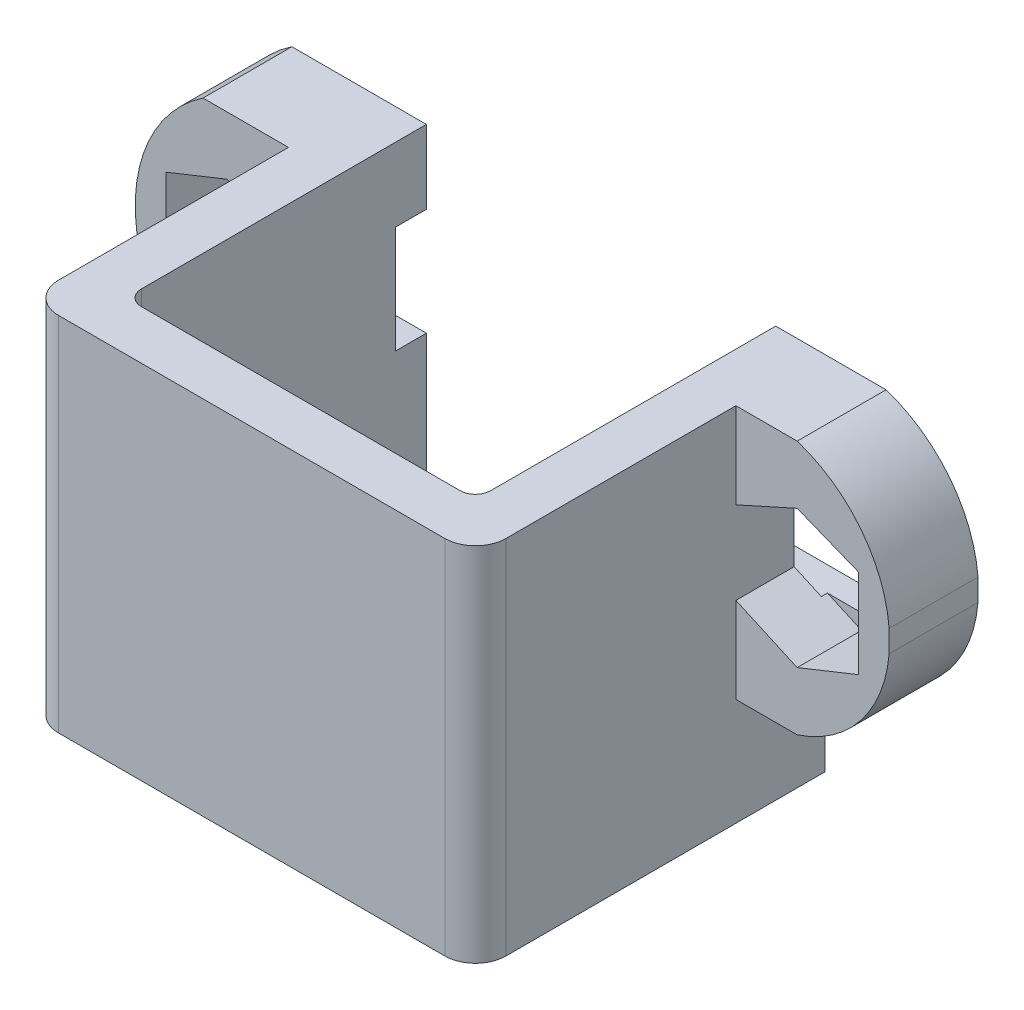
from build123d import *

# Parameters (mm, degrees)
EXTRUDE_1_DEPTH      = 11.4
SKETCH_2_W           = 11.4
SKETCH_2_H           = 8.3
CUT_EXTRUDE_1_DEPTH  = 9.8
CUT_EXTRUDE_2_DEPTH  = 10.6
CUT_EXTRUDE_3_DEPTH  = 0.8
CUT_EXTRUDE_4_DEPTH  = 8.5
CUT_EXTRUDE_5_DEPTH  = 0.8
CUT_EXTRUDE_6_DEPTH  = 2.1
CUT_EXTRUDE_7_DEPTH  = 0.2
CUT_EXTRUDE_8_DEPTH  = 1
CUT_EXTRUDE_9_DEPTH  = 8.5
CUT_EXTRUDE_10_DEPTH = 1.9
CUT_EXTRUDE_11_DEPTH = 0.2
EXTRUDE_2_DEPTH      = 3.5
FILLET_1_R           = 0.5
FILLET_2_R           = 1
FILLET_3_R           = 1.5


with BuildPart() as part:
    # 草图1 → 凸台-拉伸1 (new body)
    with BuildSketch(Plane.XY.offset(1.6)):
        with BuildLine():
            Line((-10.088816953, -2.4), (9.3, -2.4))
            ThreePointArc((9.3, -2.4), (11.373008704, -0.957826085), (12.3, 1.391198782))
            Line((12.3, 1.391198782), (12.3, 2.108801218))
            ThreePointArc((12.3, 2.108801218), (11.373008704, 4.457826085), (9.3, 5.9))
            Line((9.3, 5.9), (-10.088816953, 5.9))
            ThreePointArc((-10.088816953, 5.9), (-12.3, 1.75), (-10.088816953, -2.4))
        make_face()
        with BuildLine():
            Line((-7.8, 0), (-10.8, 0))
            Line((-10.8, 0), (-11.007, 0.0828))
            Line((-11.007, 0.0828), (-11.007, 2))
            ThreePointArc((-11.007, 2), (-10.567660172, 3.060660172), (-9.507, 3.5))
            Line((-9.507, 3.5), (-8.05, 3.5))
            Line((-8.05, 3.5), (-7.3, 3.2))
            Line((-7.3, 3.2), (-7.3, 0.2))
            Line((-7.3, 0.2), (-7.8, 0))
        make_face(mode=Mode.SUBTRACT)
        with BuildLine():
            Line((7.3, 0.4), (7.3, 3.1))
            Line((7.3, 3.1), (8.188888889, 3.5))
            Line((8.188888889, 3.5), (9.206872393, 3.5))
            ThreePointArc((9.206872393, 3.5), (10.461862433, 2.99034879), (11.006177815, 1.75))
            ThreePointArc((11.006177815, 1.75), (10.461862433, 0.50965121), (9.206872393, 0))
            Line((9.206872393, 0), (8.188888889, 0))
            Line((8.188888889, 0), (7.3, 0.4))
        make_face(mode=Mode.SUBTRACT)
    extrude(amount=-EXTRUDE_1_DEPTH)

    # 草图2 → 切除-拉伸1 (cut)
    with BuildSketch(Plane(origin=(0, 0, -9.8), x_dir=(-1, 0, 0), z_dir=(0, 0, -1))):
        with Locations((0, 1.75)):
            Rectangle(SKETCH_2_W, SKETCH_2_H)
    extrude(amount=-CUT_EXTRUDE_1_DEPTH, mode=Mode.SUBTRACT)

    # 草图3 → 切除-拉伸2 (cut)
    with BuildSketch(Plane.XY.offset(1.6)):
        Polygon((-7.8, 0), (-10.8, 0), (-9.3, -0.6), align=None)
    extrude(amount=-CUT_EXTRUDE_2_DEPTH, mode=Mode.SUBTRACT)

    # 草图4 → 切除-拉伸3 (cut)
    with BuildSketch(Plane(origin=(0, 0, -9.8), x_dir=(-1, 0, 0), z_dir=(0, 0, -1))):
        Polygon((11.007, 0.0828), (10.8, 0), (11.007, 0), align=None)
    extrude(amount=-CUT_EXTRUDE_3_DEPTH, mode=Mode.SUBTRACT)

    # 草图5 → 切除-拉伸4 (cut)
    with BuildSketch(Plane.XY.offset(1.6)):
        with BuildLine():
            Line((-9.507, 3.5), (-8.05, 3.5))
            Line((-8.05, 3.5), (-7.3, 3.2))
            Line((-7.3, 3.2), (-7.3, 5.9))
            Line((-7.3, 5.9), (-10.088816953, 5.9))
            ThreePointArc((-10.088816953, 5.9), (-12.3, 1.75), (-10.088816953, -2.4))
            Line((-10.088816953, -2.4), (-7.3, -2.4))
            Line((-7.3, -2.4), (-7.3, 0.2))
            Line((-7.3, 0.2), (-9.3, -0.6))
            Line((-9.3, -0.6), (-11.007, 0.0828))
            Line((-11.007, 0.0828), (-11.007, 2))
            ThreePointArc((-11.007, 2), (-10.567660172, 3.060660172), (-9.507, 3.5))
        make_face()
    extrude(amount=-CUT_EXTRUDE_4_DEPTH, mode=Mode.SUBTRACT)

    # 草图6 → 切除-拉伸5 (cut)
    with BuildSketch(Plane(origin=(0, 0, -9.8), x_dir=(-1, 0, 0), z_dir=(0, 0, -1))):
        Polygon((7.3, 3.2), (8.05, 3.5), (5.7, 3.5), (5.7, 0), (7.8, 0), (7.3, 0.2), align=None)
    extrude(amount=-CUT_EXTRUDE_5_DEPTH, mode=Mode.SUBTRACT)

    # 草图7 → 切除-拉伸6 (cut)
    with BuildSketch(Plane.XY.offset(-6.9)):
        with BuildLine():
            Line((-9.507, 3.5), (-8.05, 3.5))
            Line((-8.05, 3.5), (-9.3, 4))
            Line((-9.3, 4), (-11.3, 3.2))
            Line((-11.3, 3.2), (-11.3, 0.2))
            Line((-11.3, 0.2), (-11.007, 0.0828))
            Line((-11.007, 0.0828), (-11.007, 2))
            ThreePointArc((-11.007, 2), (-10.567660172, 3.060660172), (-9.507, 3.5))
        make_face()
    extrude(amount=-CUT_EXTRUDE_6_DEPTH, mode=Mode.SUBTRACT)

    # 草图8 → 切除-拉伸7 (cut)
    with BuildSketch(Plane(origin=(0, 0, -9), x_dir=(-1, 0, 0), z_dir=(0, 0, -1))):
        Polygon((7.3, 3.2), (8.05, 3.5), (5.7, 3.5), (5.7, 0), (7.8, 0), (7.3, 0.2), align=None)
    extrude(amount=-CUT_EXTRUDE_7_DEPTH, mode=Mode.SUBTRACT)

    # 草图9 → 切除-拉伸8 (cut)
    with BuildSketch(Plane(origin=(0, 0, -9.8), x_dir=(-1, 0, 0), z_dir=(0, 0, -1))):
        Polygon((-7.3, 0.4), (-8.188888889, 0), (-5.7, 0), (-5.7, 3.5), (-8.188888889, 3.5), (-7.3, 3.1), align=None)
    extrude(amount=-CUT_EXTRUDE_8_DEPTH, mode=Mode.SUBTRACT)

    # 草图10 → 切除-拉伸9 (cut)
    with BuildSketch(Plane.XY.offset(1.6)):
        with BuildLine():
            Line((9.206872393, 0), (8.188888889, 0))
            Line((8.188888889, 0), (7.3, 0.4))
            Line((7.3, 0.4), (7.3, -2.4))
            Line((7.3, -2.4), (9.3, -2.4))
            ThreePointArc((9.3, -2.4), (11.373008704, -0.957826085), (12.3, 1.391198782))
            Line((12.3, 1.391198782), (12.3, 2.108801218))
            ThreePointArc((12.3, 2.108801218), (11.373008704, 4.457826085), (9.3, 5.9))
            Line((9.3, 5.9), (7.3, 5.9))
            Line((7.3, 5.9), (7.3, 3.1))
            Line((7.3, 3.1), (8.188888889, 3.5))
            Line((8.188888889, 3.5), (9.206872393, 3.5))
            ThreePointArc((9.206872393, 3.5), (10.461862433, 2.99034879), (11.006177815, 1.75))
            ThreePointArc((11.006177815, 1.75), (10.461862433, 0.50965121), (9.206872393, 0))
        make_face()
    extrude(amount=-CUT_EXTRUDE_9_DEPTH, mode=Mode.SUBTRACT)

    # 草图11 → 切除-拉伸10 (cut)
    with BuildSketch(Plane.XY.offset(-6.9)):
        with BuildLine():
            Line((9.206872393, 0), (8.188888889, 0))
            Line((8.188888889, 0), (9.3, -0.5))
            Line((9.3, -0.5), (11.3, 0.3))
            Line((11.3, 0.3), (11.3, 3.2))
            Line((11.3, 3.2), (9.3, 4))
            Line((9.3, 4), (8.188888889, 3.5))
            Line((8.188888889, 3.5), (9.206872393, 3.5))
            ThreePointArc((9.206872393, 3.5), (10.461862433, 2.99034879), (11.006177815, 1.75))
            ThreePointArc((11.006177815, 1.75), (10.461862433, 0.50965121), (9.206872393, 0))
        make_face()
    extrude(amount=-CUT_EXTRUDE_10_DEPTH, mode=Mode.SUBTRACT)

    # 草图12 → 切除-拉伸11 (cut)
    with BuildSketch(Plane.XY.offset(-8.8)):
        with BuildLine():
            Line((9.206872393, 0), (8.188888889, 0))
            Line((8.188888889, 0), (9.3, -0.5))
            Line((9.3, -0.5), (11.3, 0.3))
            Line((11.3, 0.3), (11.3, 3.2))
            Line((11.3, 3.2), (9.3, 4))
            Line((9.3, 4), (8.188888889, 3.5))
            Line((8.188888889, 3.5), (9.206872393, 3.5))
            ThreePointArc((9.206872393, 3.5), (10.461862433, 2.99034879), (11.006177815, 1.75))
            ThreePointArc((11.006177815, 1.75), (10.461862433, 0.50965121), (9.206872393, 0))
        make_face()
    extrude(amount=-CUT_EXTRUDE_11_DEPTH, mode=Mode.SUBTRACT)

    # 草图13 → 凸台-拉伸2 (add)
    with BuildSketch(Plane.XZ.offset(2.4)):
        Polygon((-7.3, 1.6), (7.3, 1.6), (7.3, -9.8), (5.7, -9.8), (5.7, 0), (-5.7, 0), (-5.7, -9.8), (-7.3, -9.8), align=None)
    extrude(amount=EXTRUDE_2_DEPTH)

    # 圆角1
    fillet_1_edges = [part.edges().sort_by_distance(p)[0] for p in [
        (5.7, 0, 0),
        (-5.7, 0, 0),
    ]]
    fillet(fillet_1_edges, radius=FILLET_1_R)

    # 圆角2
    fillet_2_edges = [part.edges().sort_by_distance(p)[0] for p in [
        (-7.3, 0, 1.6),
        (7.3, 0, 1.6),
    ]]
    fillet(fillet_2_edges, radius=FILLET_2_R)

    # 圆角3
    # the kernel refuses this fillet: 1.5 mm, written as the material it adds along each edge
    with BuildSketch(Plane(origin=(-11.007, 0, -9.8), x_dir=(1.0, 7.597747752272154e-12, 0), z_dir=(0, 0, 1))) as fillet_3_piece_1:
        with BuildLine():
            CenterArc((FILLET_3_R, FILLET_3_R), FILLET_3_R, 180, 90)
            Line((0, FILLET_3_R), (0, 0))
            Line((0, 0), (FILLET_3_R, 0))
        make_face()
    extrude(amount=0.8)


solid = part.part
